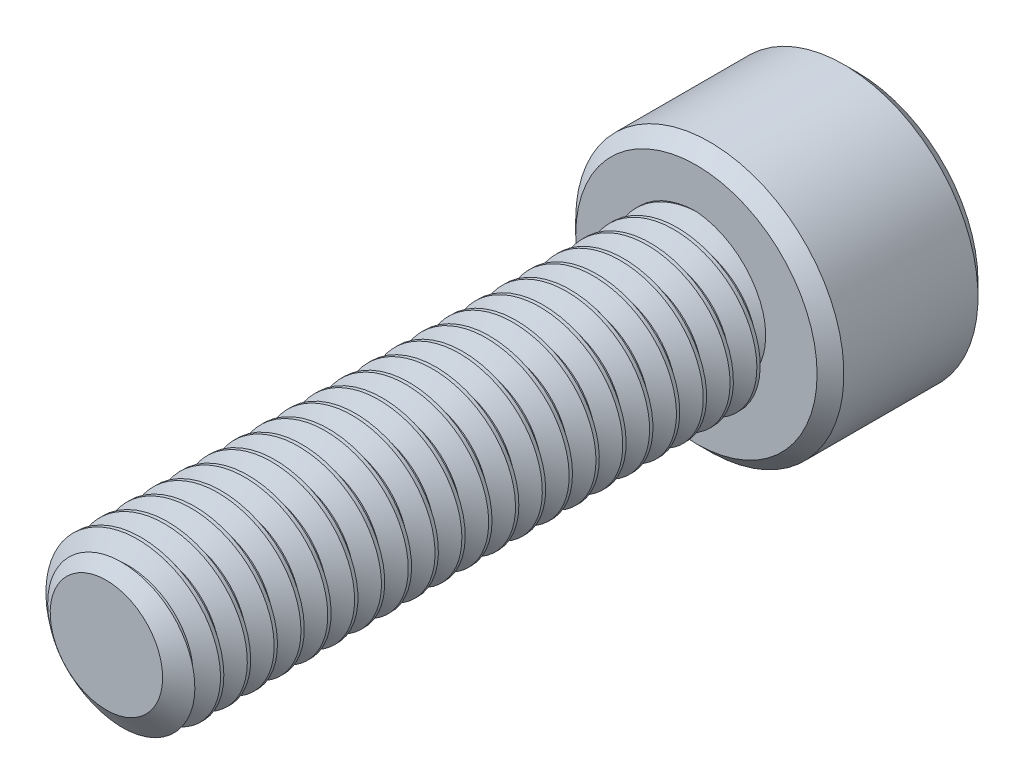
from build123d import *

# Parameters (mm, degrees)
SKETCH1_R          = 3
EXTRUDE1_DEPTH     = 22
CUT_SWEEP1_PITCH   = 1
SKETCH6_R          = 5
EXTRUDE2_DEPTH     = 6
CUT_EXTRUDE1_DEPTH = 3.75
CHAMFER1_SIZE      = 0.5


with BuildPart() as part:
    # Sketch1 → Extrude1 (new body)
    with BuildSketch(Plane.XY):
        Circle(SKETCH1_R)
    extrude(amount=-EXTRUDE1_DEPTH)

    # Cut-Sweep1: arcs per turn and ends read off the stored shape
    # Cut-Sweep1: the profile of Sketch3 profile screwed along a right-hand helix through 25 turns, 6 arcs to a turn; built about Z, then put on its axis
    cut_sweep1_z = Axis((0, 0, 0), (0, 0, 1))
    cut_sweep1_corners = [(3.0003, 0, -1.875173205), (2.350480947, 0, -1.5), (2.350480947, 0, -1.375), (3.0003, 0, -0.999826795)]
    with BuildLine(mode=Mode.PRIVATE) as cut_sweep1_profile:
        Line(cut_sweep1_corners[0], cut_sweep1_corners[1])
        Line(cut_sweep1_corners[1], cut_sweep1_corners[2])
        Line(cut_sweep1_corners[2], cut_sweep1_corners[3])
        Line(cut_sweep1_corners[3], cut_sweep1_corners[0])
    cut_sweep1_cap = Face(cut_sweep1_profile.wire())
    cut_sweep1_turn_angles = [0, 30, 60, 90, 120, 150, 180, 210, 240, 270, 300, 330, 360]
    cut_sweep1_turn_weights = [1, 0.8660254037844387, 1, 0.8660254037844387, 1, 0.8660254037844387, 1, 0.8660254037844387, 1, 0.8660254037844387, 1, 0.8660254037844387, 1]
    cut_sweep1_turn_rails = [Edge.make_bspline([Vector(p[0], p[1], 0).rotate(cut_sweep1_z, cut_sweep1_turn_angles[k]) / cut_sweep1_turn_weights[k] + Vector(0, 0, p[2] + CUT_SWEEP1_PITCH * cut_sweep1_turn_angles[k] / 360) for k in range(13)], [0, 0, 0, 1, 1, 2, 2, 3, 3, 4, 4, 5, 5, 6, 6, 6], 2, cut_sweep1_turn_weights) for p in cut_sweep1_corners]
    cut_sweep1_turn_sides = [Face.make_surface_from_curves(cut_sweep1_turn_rails[p[0]], cut_sweep1_turn_rails[p[1]]) for p in [(0, 1), (1, 2), (2, 3), (3, 0)]]
    cut_sweep1 = Plane(origin=(0, 0, 0), x_dir=(0, 1, 0), z_dir=(0, 0, -1)) * Solid(Shell([*[p.moved(Location((0, 0, CUT_SWEEP1_PITCH * i))) for i in range(25) for p in cut_sweep1_turn_sides], cut_sweep1_cap, cut_sweep1_cap.rotate(cut_sweep1_z, 9000).moved(Location((0, 0, CUT_SWEEP1_PITCH * 9000 / 360)))]))
    add(cut_sweep1, mode=Mode.SUBTRACT)

    # Sketch4 → Cut-Revolve1 (revolve, cut)
    with BuildSketch(Plane(origin=(0, 0, 0), x_dir=(0, 0, -1), z_dir=(1, 0, 0)), mode=Mode.PRIVATE) as cut_revolve1_sk:
        Polygon((0.632650852, 3), (0, 2.096480947), (0, 3), align=None)
    revolve(cut_revolve1_sk.sketch.rotate(Axis((0, 0, 0), (0, 0, -1)), 270), axis=Axis((0, 0, 0), (0, 0, -1)), mode=Mode.SUBTRACT)

    # Sketch6 → Extrude2 (add)
    with BuildSketch(Plane(origin=(0, 0, -22), x_dir=(-1, 0, 0), z_dir=(0, 0, -1))):
        Circle(SKETCH6_R)
    extrude(amount=EXTRUDE2_DEPTH)

    # Sketch7 → Cut-Extrude1 (cut)
    with BuildSketch(Plane(origin=(0, 0, -28), x_dir=(-1, 0, 0), z_dir=(0, 0, -1))):
        Polygon((0, 2.886751346), (-2.5, 1.443375673), (-2.5, -1.443375673), (0, -2.886751346), (2.5, -1.443375673), (2.5, 1.443375673), align=None)
    extrude(amount=-CUT_EXTRUDE1_DEPTH, mode=Mode.SUBTRACT)

    # Cut-Extrude2 cone 1 section (through the dimple's axis) → Cut-Extrude2 (revolve, cut)
    with BuildSketch(Plane(origin=(0, 0, -28), x_dir=(0, 1, 0), z_dir=(1, 0, 0))):
        Polygon((0, 0), (2.886751346, 0), (0, 2.886751346), align=None)
    revolve(axis=Axis((0, 0, -28), (0, 0, 1)), mode=Mode.SUBTRACT)

    # Chamfer1
    chamfer1_edges = [part.edges().sort_by_distance(p)[0] for p in [
        (5, 0, -22),
        (5, 0, -28),
    ]]
    chamfer(chamfer1_edges, length=CHAMFER1_SIZE)


solid = part.part
